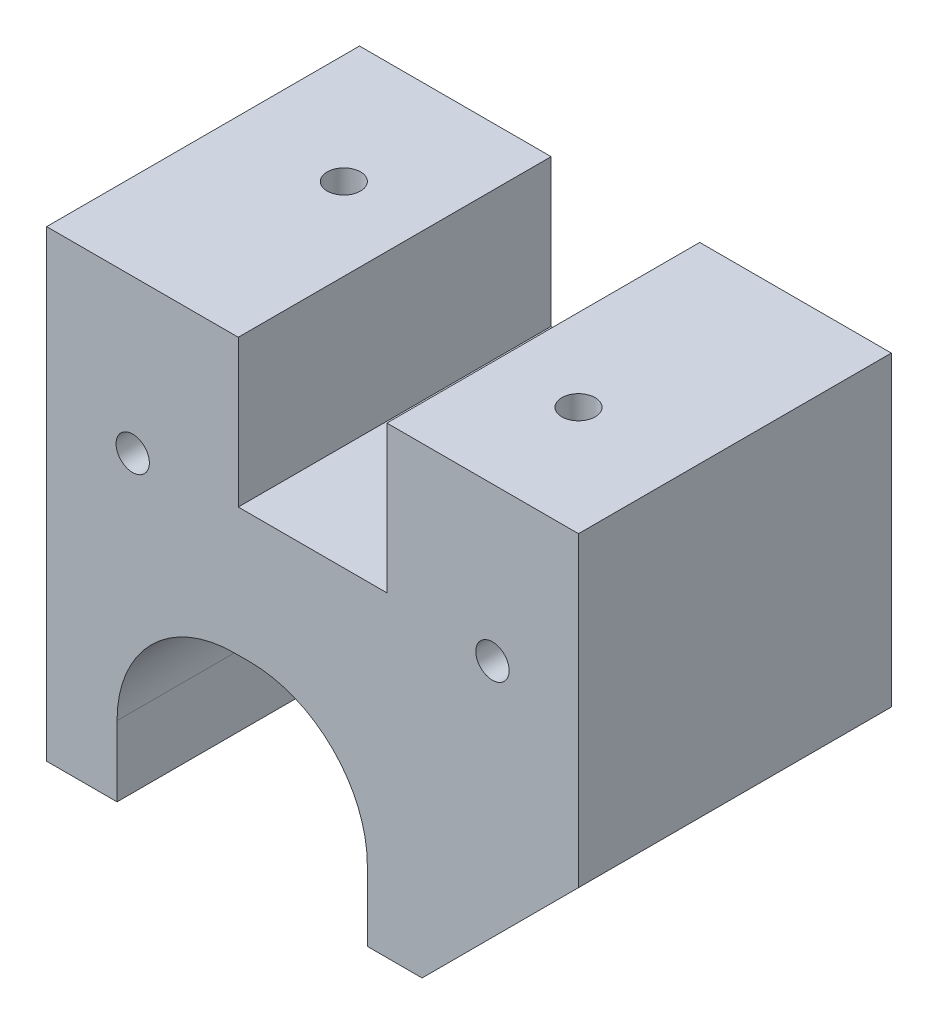
from build123d import *

# Parameters (mm, degrees)
SKETCH1_W                 = 43.18
SKETCH1_H                 = 25.4
BASE_DEPTH                = 37.592
SIDECHAMFER_SIZE          = 12.7
SKETCH2_W                 = 12.065
SKETCH2_H                 = 11.938
LINACTSLOT_DEPTH          = 51.24387091
MOUTINGHOLES_D            = 2.7051
MOUTINGHOLES_DEPTH        = 14.478
MOUTINGHOLES_TIP          = 0.81269403
MOTORSLOT_DEPTH           = 51.24387091
MOTORMOUNTINGHOLES2_D     = 2.2606
MOTORMOUNTINGHOLES2_DEPTH = 11.43
MOTORMOUNTINGHOLES2_TIP   = 0.679152758
F_6_32_TAPPED_HOLE1_D     = 2.7051
F_6_32_TAPPED_HOLE1_DEPTH = 7.62
F_6_32_TAPPED_HOLE1_TIP   = 0.81269403


with BuildPart() as part:
    # Sketch1 → Base (new body)
    with BuildSketch(Plane(origin=(0, 0, 0), x_dir=(1, 0, 0), z_dir=(0, 1, 0))):
        Rectangle(SKETCH1_W, SKETCH1_H)
    extrude(amount=BASE_DEPTH)

    # SideChamfer
    sidechamfer_edges = [part.edges().sort_by_distance(p)[0] for p in [
        (21.59, 0, 0),
    ]]
    chamfer(sidechamfer_edges, length=SIDECHAMFER_SIZE)

    # Sketch2 → LinActSlot (cut, through all)
    with BuildSketch(Plane.XY.offset(12.7)):
        with Locations((0, 31.623)):
            Rectangle(SKETCH2_W, SKETCH2_H)
    extrude(amount=-LINACTSLOT_DEPTH, mode=Mode.SUBTRACT)

    # MoutingHoles
    with Locations(Plane(origin=(14.160350453, 37.592, 8.373414988), x_dir=(-1, 0, 0), z_dir=(0, 1, 0))):
        with Locations((1.460350453, -4.563414988), (26.860350453, -10.913414988)):
            Hole(MOUTINGHOLES_D / 2, depth=MOUTINGHOLES_DEPTH)
            with Locations((0, 0, -(MOUTINGHOLES_DEPTH + MOUTINGHOLES_TIP / 2))):  # 118° drill point
                Cone(0, MOUTINGHOLES_D / 2, MOUTINGHOLES_TIP, mode=Mode.SUBTRACT)

    # Sketch11 → MotorSlot (cut, through all)
    with BuildSketch(Plane(origin=(0, 0, -12.7), x_dir=(-1, 0, 0), z_dir=(0, 0, -1))):
        with BuildLine():
            Line((15.875, 5.08), (15.875, 5.715))
            ThreePointArc((15.875, 5.715), (13.085192091, 12.450192091), (6.35, 15.24))
            Line((6.35, 15.24), (5.08, 15.24))
            ThreePointArc((5.08, 15.24), (-1.655192091, 12.450192091), (-4.445, 5.715))
            Line((-4.445, 5.715), (-4.445, 5.08))
            Line((-4.445, 5.08), (-4.445, 0))
            Line((-4.445, 0), (15.875, 0))
            Line((15.875, 0), (15.875, 5.08))
        make_face()
    extrude(amount=-MOTORSLOT_DEPTH, mode=Mode.SUBTRACT)

    # MotorMountingHoles2
    with Locations(Plane(origin=(0, 0, -12.7), x_dir=(-1, 0, 0), z_dir=(0, 0, -1))):
        with Locations((18.215, 5.715), (-6.785, 5.715)):
            Hole(MOTORMOUNTINGHOLES2_D / 2, depth=MOTORMOUNTINGHOLES2_DEPTH)
            with Locations((0, 0, -(MOTORMOUNTINGHOLES2_DEPTH + MOTORMOUNTINGHOLES2_TIP / 2))):  # 118° drill point
                Cone(0, MOTORMOUNTINGHOLES2_D / 2, MOTORMOUNTINGHOLES2_TIP, mode=Mode.SUBTRACT)

    # #6-32 Tapped Hole1
    with Locations(Plane.XY.offset(12.7)):
        with Locations((-14.605, 25.146), (14.605, 25.146)):
            Hole(F_6_32_TAPPED_HOLE1_D / 2, depth=F_6_32_TAPPED_HOLE1_DEPTH)
            with Locations((0, 0, -(F_6_32_TAPPED_HOLE1_DEPTH + F_6_32_TAPPED_HOLE1_TIP / 2))):  # 118° drill point
                Cone(0, F_6_32_TAPPED_HOLE1_D / 2, F_6_32_TAPPED_HOLE1_TIP, mode=Mode.SUBTRACT)


solid = part.part
